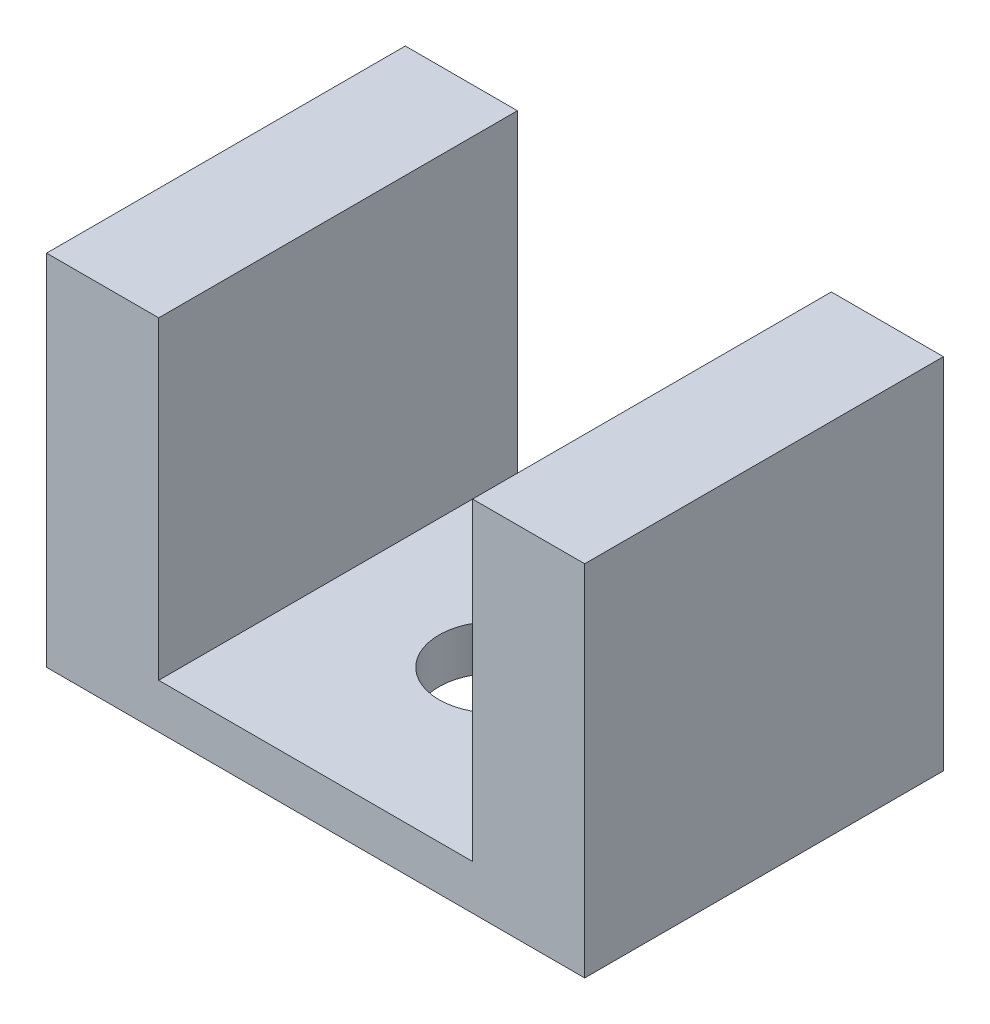
from build123d import *

# Parameters (mm, degrees)
BOSS_EXTRUDE1_DEPTH = 50.8
SKETCH2_R           = 7.9375
CUT_EXTRUDE1_DEPTH  = 78.51162816


with BuildPart() as part:
    # Sketch1 → Boss-Extrude1 (new body)
    with BuildSketch(Plane.XY):
        Polygon((22.225, 0), (-22.225, 0), (-22.225, 44.45), (-38.1, 44.45), (-38.1, -6.35), (38.1, -6.35), (38.1, 44.45), (22.225, 44.45), align=None)
    extrude(amount=BOSS_EXTRUDE1_DEPTH)

    # Sketch2 → Cut-Extrude1 (cut, through all)
    with BuildSketch(Plane(origin=(0, 0, 0), x_dir=(1, 0, 0), z_dir=(0, 1, 0))):
        with Locations((0, -25.4)):
            Circle(SKETCH2_R)
    extrude(amount=-CUT_EXTRUDE1_DEPTH, mode=Mode.SUBTRACT)


solid = part.part
